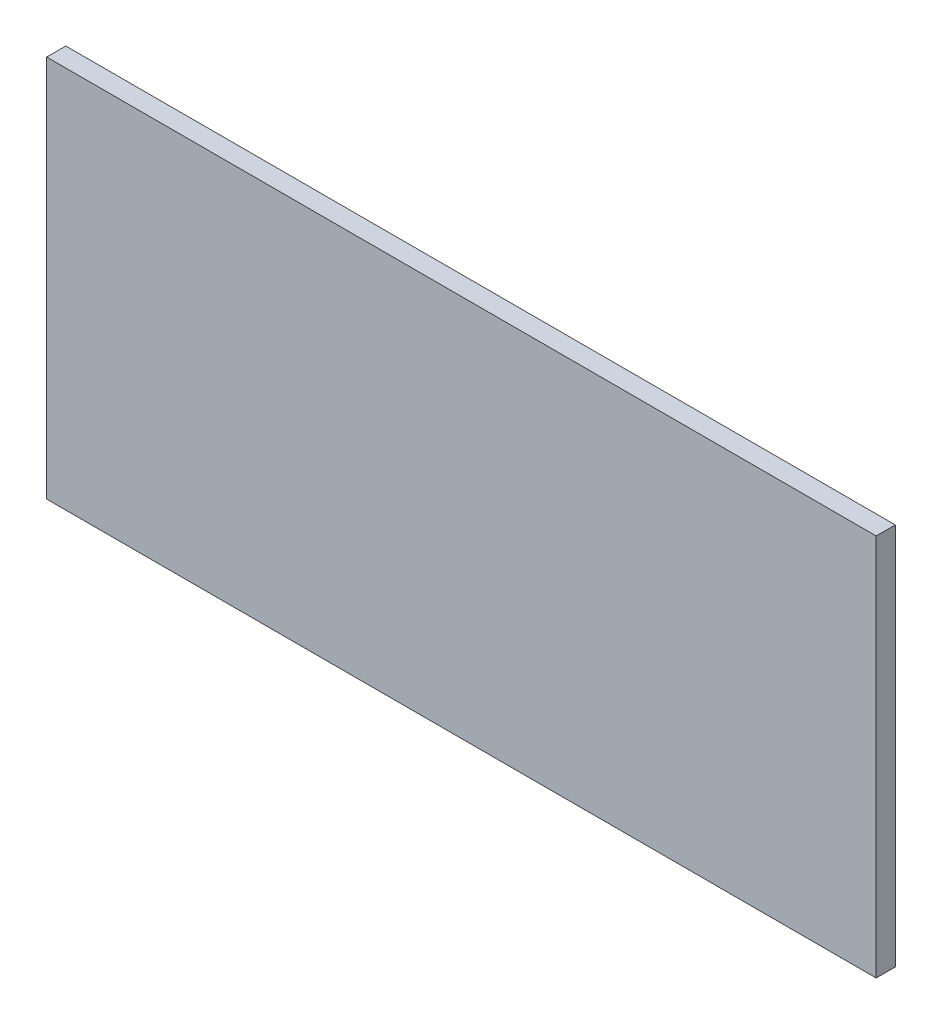
from build123d import *

# Parameters (mm, degrees)
SKETCH1_W           = 65
SKETCH1_H           = 30
BOSS_EXTRUDE1_DEPTH = 1.5
BOSS_EXTRUDE2_DEPTH = 1.5


with BuildPart() as part:
    # Sketch1 → Boss-Extrude1 (new body)
    with BuildSketch(Plane.XY):
        with Locations((159.760155452, 18.3614)):
            Rectangle(SKETCH1_W, SKETCH1_H)
    extrude(amount=-BOSS_EXTRUDE1_DEPTH)


with BuildPart() as body_2:
    # Sketch2 → Boss-Extrude2 (new body)
    with BuildSketch(Plane(origin=(0, 0, -1.5), x_dir=(-1, 0, 0), z_dir=(0, 0, -1))):
        with BuildLine():
            Line((-182.260155452, 27.8614), (-137.260155452, 27.8614))
            ThreePointArc((-137.260155452, 27.8614), (-135.492388499, 27.129166953), (-134.760155452, 25.3614))
            Line((-134.760155452, 25.3614), (-134.760155452, 11.3614))
            ThreePointArc((-134.760155452, 11.3614), (-135.492388499, 9.593633047), (-137.260155452, 8.8614))
            Line((-137.260155452, 8.8614), (-182.260155452, 8.8614))
            ThreePointArc((-182.260155452, 8.8614), (-184.027922405, 9.593633047), (-184.760155452, 11.3614))
            Line((-184.760155452, 11.3614), (-184.760155452, 25.3614))
            ThreePointArc((-184.760155452, 25.3614), (-184.027922405, 27.129166953), (-182.260155452, 27.8614))
        make_face()
    extrude(amount=BOSS_EXTRUDE2_DEPTH)


solid = Compound([part.part, body_2.part])
